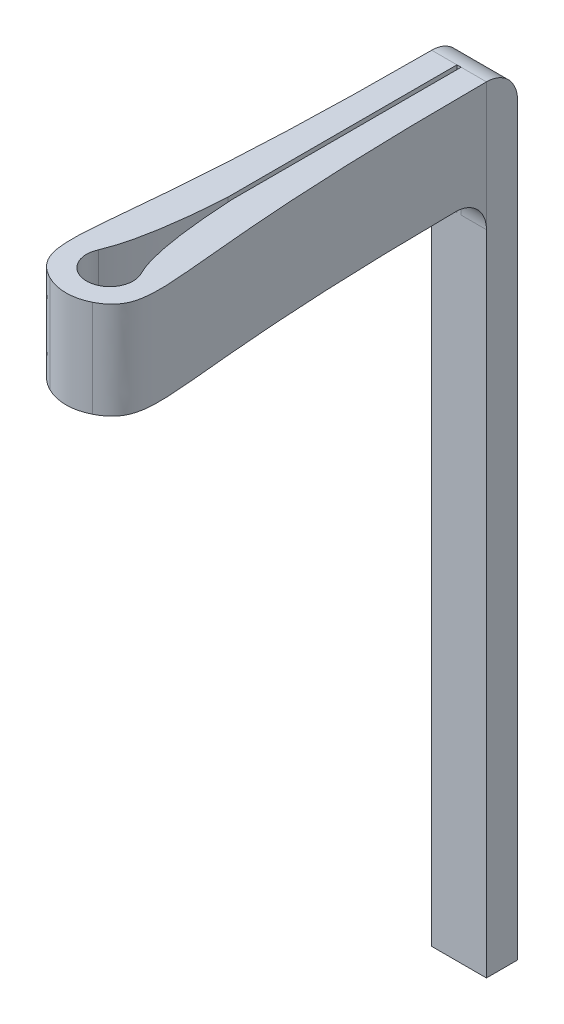
from build123d import *

# Parameters (mm, degrees)
BOSS_EXTRUDE1_DEPTH      = 1.5875
BOSS_EXTRUDE1_DEPTH_BACK = 1.5875
FILLET1_R                = 1.524
BOSS_EXTRUDE2_DEPTH      = 0.89581
BOSS_EXTRUDE2_DEPTH_BACK = 0.89581
FILLET2_R                = 1.016


with BuildPart() as part:
    # Sketch1 → Boss-Extrude1 (new, two sides: drawn at the far end of the back side and taken through both)
    with BuildSketch(Plane(origin=(0, 0, 0), x_dir=(1, 0, 0), z_dir=(0, 1, 0)).offset(-BOSS_EXTRUDE1_DEPTH_BACK)):
        with BuildLine():
            Line((-0.068296764, 6.214618695), (-0.068296764, 13.71487153))
            Line((-0.068296764, 13.71487153), (-0.895808533, 13.71487153))
            add(Edge.make_bspline(
                [(-0.895808533, 13.71487153), (-0.895808533, 4.54222596), (-1.588668774, 2.219313027), (-2.088196173, 1.337696034), (0, 0.766240154)],
                knots=[0, 0, 0, 0, 0, 1, 1, 1, 1, 1], degree=4))
            add(Edge.make_bspline(
                [(0.895808533, 13.71487153), (0.895808533, 4.54222596), (1.588668774, 2.219313027), (2.088196173, 1.337696034), (0, 0.766240154)],
                knots=[0, 0, 0, 0, 0, 1, 1, 1, 1, 1], degree=4))
            Line((0.895808533, 13.71487153), (0.068296764, 13.71487153))
            Line((0.068296764, 13.71487153), (0.068296764, 6.214618695))
            add(Edge.make_bspline(
                [(0.690807422, 2.606475487), (0.218071276, 3.482132924), (0.068296764, 6.214618695)],
                knots=[0, 0, 0, 1, 1, 1], degree=2))
            ThreePointArc((0.690807422, 2.606475487), (0, 1.52287153), (-0.690807422, 2.606475487))
            add(Edge.make_bspline(
                [(-0.690807422, 2.606475487), (-0.217222133, 3.738734236), (-0.068296764, 6.214618695)],
                knots=[0, 0, 0, 1, 1, 1], degree=2))
        make_face()
    extrude(amount=BOSS_EXTRUDE1_DEPTH + BOSS_EXTRUDE1_DEPTH_BACK)

    # Fillet1
    fillet1_edges = [part.edges().sort_by_distance(p)[0] for p in [
        (0, -0.79375, -0.766240154),
    ]]
    fillet(fillet1_edges, radius=FILLET1_R)

    # Sketch2 → Boss-Extrude2 (add, two sides: drawn at the far end of the back side and taken through both)
    with BuildSketch(Plane(origin=(0, 0, 0), x_dir=(0, 0, -1), z_dir=(1, 0, 0)).offset(-BOSS_EXTRUDE2_DEPTH_BACK)):
        Polygon((13.71487153, 1.5875), (13.71487153, -1.5875), (13.71487153, -23.8125), (14.73087153, -23.8125), (14.73087153, 1.5875), align=None)
    extrude(amount=BOSS_EXTRUDE2_DEPTH + BOSS_EXTRUDE2_DEPTH_BACK)

    # Fillet2
    fillet2_edges = [part.edges().sort_by_distance(p)[0] for p in [
        (0, 1.5875, -14.73087153),
        (0.482052648, -1.5875, -13.71487153),
        (-0.482052648, -1.5875, -13.71487153),
    ]]
    fillet(fillet2_edges, radius=FILLET2_R - 0.0001)  # a hair under: the kernel refuses the full size


solid = part.part
